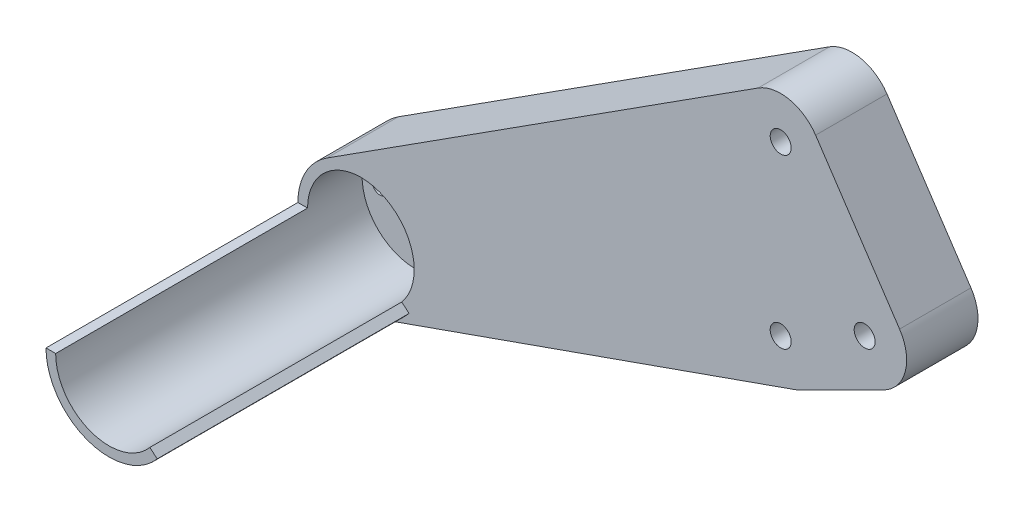
from build123d import *

# Parameters (mm, degrees)
BOSS_EXTRUDE1_DEPTH = 17
SKETCH2_R           = 2.5
CUT_EXTRUDE1_DEPTH  = 127.546434165
SKETCH3_R           = 1.7
CUT_EXTRUDE2_DEPTH  = 127.546434165
SKETCH6_R           = 12.7
CUT_EXTRUDE5_DEPTH  = 13
SKETCH5_R           = 5.5
CUT_EXTRUDE4_DEPTH  = 0.9
BOSS_EXTRUDE3_DEPTH = 60


with BuildPart() as part:
    # Sketch1 → Boss-Extrude1 (new body)
    with BuildSketch(Plane.XY):
        with BuildLine():
            Line((3.328897286, -9.429657621), (-95.00665407, -44.144486432))
            ThreePointArc((-95.00665407, -44.144486432), (-113.476816743, -36.586001098), (-108.091360043, -17.369485653))
            Line((-108.091360043, -17.369485653), (-5.394240028, 48.420342898))
            ThreePointArc((-5.394240028, 48.420342898), (2.050554972, 49.787503477), (8.320502943, 45.547001962))
            Line((8.320502943, 45.547001962), (28.320502943, 15.547001962))
            ThreePointArc((28.320502943, 15.547001962), (29.664996488, 7.433320648), (24.472135955, 1.05572809))
            Line((24.472135955, 1.05572809), (4.472135955, -8.94427191))
            ThreePointArc((4.472135955, -8.94427191), (3.908059586, -9.204730863), (3.328897286, -9.429657621))
        make_face()
    extrude(amount=BOSS_EXTRUDE1_DEPTH)

    # Sketch2 → Cut-Extrude1 (cut, through all)
    with BuildSketch(Plane.XY.offset(17)):
        with Locations((-100, -30)):
            Circle(SKETCH2_R)
        Circle(SKETCH2_R)
        with Locations((0, 40)):
            Circle(SKETCH2_R)
        with Locations((20, 10)):
            Circle(SKETCH2_R)
    extrude(amount=-CUT_EXTRUDE1_DEPTH, mode=Mode.SUBTRACT)

    # Sketch3 → Cut-Extrude2 (cut, through all)
    with BuildSketch(Plane.XY.offset(17)):
        with Locations((-108.5, -30)):
            Circle(SKETCH3_R)
        with Locations((-91.5, -30)):
            Circle(SKETCH3_R)
    extrude(amount=-CUT_EXTRUDE2_DEPTH, mode=Mode.SUBTRACT)

    # Sketch6 → Cut-Extrude5 (cut)
    with BuildSketch(Plane.XY.offset(17)):
        with Locations((-100, -30)):
            Circle(SKETCH6_R)
    extrude(amount=-CUT_EXTRUDE5_DEPTH, mode=Mode.SUBTRACT)

    # Sketch5 → Cut-Extrude4 (cut)
    with BuildSketch(Plane.XY.offset(4)):
        with Locations((-100, -30)):
            Circle(SKETCH5_R)
    extrude(amount=-CUT_EXTRUDE4_DEPTH, mode=Mode.SUBTRACT)

    # Sketch9 → Boss-Extrude3 (add)
    with BuildSketch(Plane.XY.offset(17)):
        with BuildLine():
            Line((-90.271235572, -38.163402643), (-88.509333353, -39.641814145))
            ThreePointArc((-88.509333353, -39.641814145), (-105.13030215, -44.095389312), (-115, -30))
            Line((-115, -30), (-112.7, -30))
            ThreePointArc((-112.7, -30), (-104.34365582, -41.934096284), (-90.271235572, -38.163402643))
        make_face()
    extrude(amount=BOSS_EXTRUDE3_DEPTH)


solid = part.part
